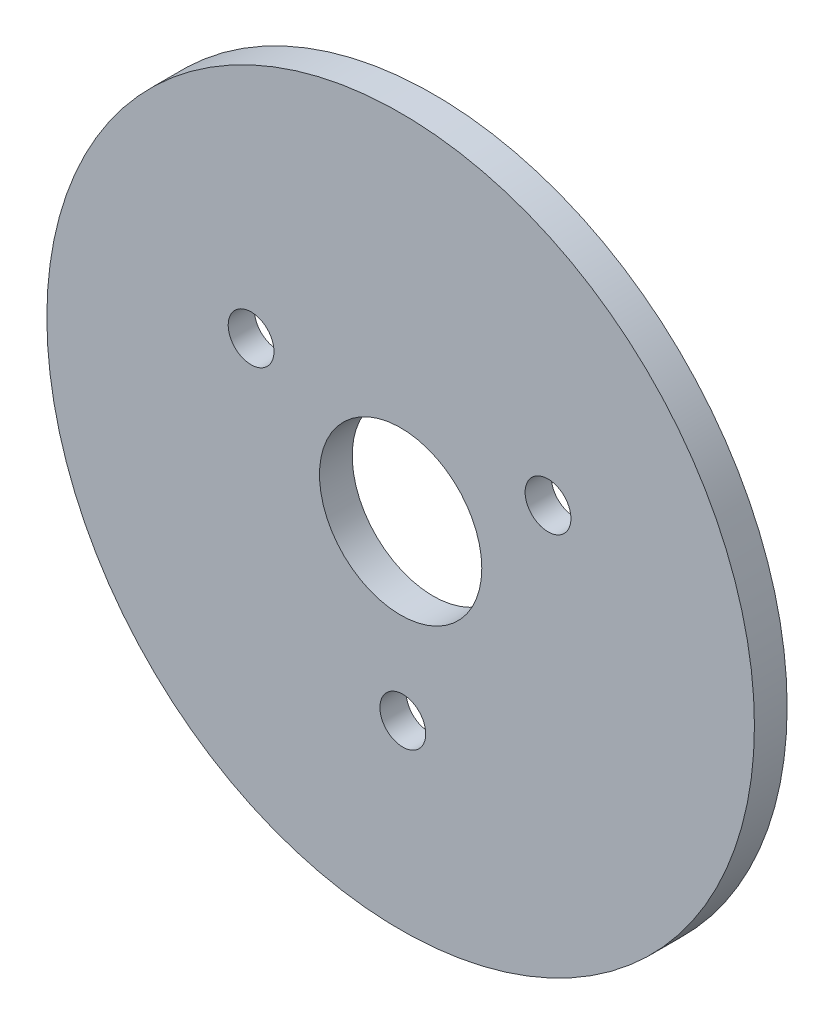
from build123d import *

# Parameters (mm, degrees)
BOSS_EXTRUDE1_DEPTH      = 7.25
BOSS_EXTRUDE1_DEPTH_BACK = 7.25
SKETCH7_R                = 22.031647778
CUT_EXTRUDE3_DEPTH       = 36.98314894
CUT_EXTRUDE3_DEPTH_BACK  = 36.98314894
SKETCH15_R               = 8.008120878
SKETCH15_R_2             = 2.25
BOSS_EXTRUDE2_DEPTH      = 5.5
SKETCH16_R               = 5
CUT_EXTRUDE4_DEPTH       = 3
BOSS_EXTRUDE3_START      = 7.5
SKETCH17_R               = 22.031647778
SKETCH17_R_2             = 5
BOSS_EXTRUDE3_DEPTH      = 7.5
CUT_EXTRUDE2_DEPTH       = 36.98314894
CUT_EXTRUDE2_DEPTH_BACK  = 36.98314894
FILLET2_R                = 0.51
BOSS_EXTRUDE4_START      = 2.5
SKETCH18_R               = 27.031647778
SKETCH18_R_2             = 22.031647778
SKETCH18_R_3             = 5
BOSS_EXTRUDE4_DEPTH      = 2.5
BOSS_EXTRUDE5_START      = -2.5
SKETCH19_R               = 27.031647778
SKETCH19_R_2             = 19
BOSS_EXTRUDE5_DEPTH      = 2.5
CUT_EXTRUDE5_DEPTH       = 52.999831377
SKETCH21_R               = 8.008120878
SKETCH21_R_2             = 6.2
SKETCH21_R_3             = 2.25
BOSS_EXTRUDE6_DEPTH      = 2.5
SKETCH21_4_R             = 8.008120878
SKETCH21_4_R_2           = 6.2
BOSS_EXTRUDE7_DEPTH      = 12
CUT_EXTRUDE6_DEPTH       = 43.254230122
CUT_EXTRUDE6_DEPTH_BACK  = 43.254230122
SKETCH22_W               = 54.063295556
SKETCH22_H               = 32.75
SKETCH24_R               = 1.75
CUT_EXTRUDE7_DEPTH       = 39.310180934
SKETCH24_3_R             = 5
SKETCH24_3_R_2           = 1.75
CUT_EXTRUDE8_DEPTH       = 0.5
FILLET4_R                = 0.5


with BuildPart() as part:
    # Sketch7 → Boss-Extrude1 (new, two sides: drawn at the far end of the back side and taken through both)
    with BuildSketch(Plane.XY.offset(-BOSS_EXTRUDE1_DEPTH_BACK)):
        Circle(SKETCH7_R)
    extrude(amount=BOSS_EXTRUDE1_DEPTH + BOSS_EXTRUDE1_DEPTH_BACK)

    # Sketch14 → Revolve1 (revolve)
    with BuildSketch(Plane(origin=(0, 0, 0), x_dir=(0, 0, -1), z_dir=(1, 0, 0)), mode=Mode.PRIVATE) as revolve1_sk:
        Polygon((-18, 6.739517467), (-18, 0), (0, 0), (0, 19), (-3.355534752, 19), (-11.020158508, 12.583105693), align=None)
        with BuildLine():
            ThreePointArc((-7.25, 19), (-8.580081567, 15.465471544), (-11.020158508, 12.583105693))
            Line((-11.020158508, 12.583105693), (-3.355534752, 19))
            Line((-3.355534752, 19), (-7.25, 19))
        make_face()
        with BuildLine():
            Line((-18, 10), (-18, 6.739517467))
            Line((-18, 6.739517467), (-11.020158508, 12.583105693))
            ThreePointArc((-11.020158508, 12.583105693), (-14.286666254, 10.687865845), (-18, 10))
        make_face()
    revolve(revolve1_sk.sketch.rotate(Axis((0, 0, -36.129595921), (0, 0, 1)), 270), axis=Axis((0, 0, -36.129595921), (0, 0, 1)))

    # Sketch10 → Cut-Extrude3 (cut, two sides: drawn at the far end of the back side and taken through both)
    with BuildSketch(Plane.XY.offset(-CUT_EXTRUDE3_DEPTH_BACK)):
        with BuildLine():
            Line((2.2, 7.7), (-2.2, 7.7))
            Line((-2.2, 7.7), (-2.2, 5.796550698))
            ThreePointArc((-2.2, 5.796550698), (0, 6.2), (2.2, 5.796550698))
            Line((2.2, 5.796550698), (2.2, 7.7))
        make_face()
        with BuildLine():
            ThreePointArc((2.2, 5.796550698), (0, 6.2), (-2.2, 5.796550698))
            Line((-2.2, 5.796550698), (-2.2, 0))
            Line((-2.2, 0), (2.2, 0))
            Line((2.2, 0), (2.2, 5.796550698))
        make_face()
        with BuildLine():
            Line((-2.2, 0), (-2.2, 5.796550698))
            ThreePointArc((-2.2, 5.796550698), (-3.521363372, -5.102940329), (6.2, 0))
            ThreePointArc((6.2, 0), (5.102940329, 3.521363372), (2.2, 5.796550698))
            Line((2.2, 5.796550698), (2.2, 0))
            Line((2.2, 0), (-2.2, 0))
        make_face()
    extrude(amount=CUT_EXTRUDE3_DEPTH + CUT_EXTRUDE3_DEPTH_BACK, mode=Mode.SUBTRACT)

    # Sketch15 → Boss-Extrude2 (add)
    with BuildSketch(Plane(origin=(0, 0, -7.25), x_dir=(-1, 0, 0), z_dir=(0, 0, -1))):
        Circle(SKETCH15_R)
        Circle(SKETCH15_R_2, mode=Mode.SUBTRACT)
    extrude(amount=-BOSS_EXTRUDE2_DEPTH)

    # Sketch16 → Cut-Extrude4 (cut)
    with BuildSketch(Plane(origin=(0, 0, -7.25), x_dir=(-1, 0, 0), z_dir=(0, 0, -1))):
        Circle(SKETCH16_R)
    extrude(amount=-CUT_EXTRUDE4_DEPTH, mode=Mode.SUBTRACT)

    # Sketch17 → Boss-Extrude3 (add)
    with BuildSketch(Plane(origin=(0, 0, -7.25), x_dir=(-1, 0, 0), z_dir=(0, 0, -1)).offset(BOSS_EXTRUDE3_START)):
        with Locations(Location((0, 0, 0), (0, 0, 180))):
            Circle(SKETCH17_R)
        Circle(SKETCH17_R_2, mode=Mode.SUBTRACT)
    extrude(amount=-BOSS_EXTRUDE3_DEPTH)

    # Sketch8 → Cut-Extrude2 (cut, two sides: drawn at the far end of the back side and taken through both)
    with BuildSketch(Plane.XY.offset(-CUT_EXTRUDE2_DEPTH_BACK)):
        Polygon((-1.629816853, 19.998625671), (-2.369776385, 22.031647778), (2.369776385, 22.031647778), (1.629816853, 19.998625671), align=None)
        Polygon((6.645262089, 18.932559877), (6.796180007, 21.090786644), (11.125976911, 19.16303686), (9.623085654, 17.606747406), align=None)
        Polygon((13.771314846, 14.592882482), (14.787015134, 16.503136895), (17.958394952, 12.980962779), (15.952435523, 12.170502561), align=None)
        Polygon((18.516182157, 7.729963135), (20.221041008, 9.061944851), (21.68564336, 4.554362304), (19.523464367, 4.629867259), align=None)
        Polygon((20.059433359, -0.469537064), (22.15866519, 0.053860216), (21.663247022, -4.659728787), (19.718708857, -3.711314154), align=None)
        Polygon((18.134226299, -8.587850038), (20.264854855, -8.963537338), (17.89507847, -13.06811044), (16.504409446, -11.410775634), align=None)
        Polygon((13.073446767, -15.221245722), (14.867067016, -16.431057856), (11.032688279, -19.216897077), (10.436347704, -17.137210342), align=None)
        Polygon((5.752149521, -19.222749741), (6.898628226, -21.057499199), (2.262646056, -22.042907629), (2.563746633, -19.900465696), align=None)
        Polygon((-2.563746633, -19.900465696), (-2.262646056, -22.042907629), (-6.898628226, -21.057499199), (-5.752149521, -19.222749741), align=None)
        Polygon((-10.436347704, -17.137210342), (-11.032688279, -19.216897077), (-14.867067016, -16.431057856), (-13.073446767, -15.221245722), align=None)
        Polygon((-16.504409446, -11.410775634), (-17.89507847, -13.06811044), (-20.264854855, -8.963537338), (-18.134226299, -8.587850038), align=None)
        Polygon((-19.718708857, -3.711314154), (-21.663247022, -4.659728787), (-22.15866519, 0.053860216), (-20.059433359, -0.469537064), align=None)
        Polygon((-19.523464367, 4.629867259), (-21.68564336, 4.554362304), (-20.221041008, 9.061944851), (-18.516182157, 7.729963135), align=None)
        Polygon((-15.952435523, 12.170502561), (-17.958394952, 12.980962779), (-14.787015134, 16.503136895), (-13.771314846, 14.592882482), align=None)
        Polygon((-9.623085654, 17.606747406), (-11.125976911, 19.16303686), (-6.796180007, 21.090786644), (-6.645262089, 18.932559877), align=None)
    extrude(amount=CUT_EXTRUDE2_DEPTH + CUT_EXTRUDE2_DEPTH_BACK, mode=Mode.SUBTRACT)

    # Fillet2
    fillet2_edges = [part.edges().sort_by_distance(p)[0] for p in [
        (6.787047671, 20.960188161, -3.75),
        (11.035034049, 19.06886277, -3.75),
        (9.623085654, 17.606747406, -3.75),
        (6.645262089, 18.932559877, -3.75),
        (14.725553141, 16.387543699, -3.75),
        (17.837010461, 12.931920261, -3.75),
        (15.952435523, 12.170502561, -3.75),
        (13.771314846, 14.592882482, -3.75),
        (20.117876696, 8.981344056, -3.75),
        (21.55480572, 4.558931255, -3.75),
        (19.523464367, 4.629867259, -3.75),
        (18.516182157, 7.729963135, -3.75),
        (22.031636605, 0.022188433, -3.75),
        (21.545579251, -4.60233838, -3.75),
        (19.718708857, -3.711314154, -3.75),
        (20.059433359, -0.469537064, -3.75),
        (20.135926394, -8.940803772, -3.75),
        (17.810926394, -12.9678219, -3.75),
        (16.504409446, -11.410775634, -3.75),
        (18.134226299, -8.587850038, -3.75),
        (14.75853158, -16.35784978, -3.75),
        (10.996602556, -19.091051203, -3.75),
        (10.436347704, -17.137210342, -3.75),
        (13.073446767, -15.221245722, -3.75),
        (6.829252579, -20.946474955, -3.75),
        (2.280866235, -21.913264317, -3.75),
        (2.563746633, -19.900465696, -3.75),
        (5.752149521, -19.222749741, -3.75),
        (-2.280866235, -21.913264317, -3.75),
        (-6.829252579, -20.946474955, -3.75),
        (-5.752149521, -19.222749741, -3.75),
        (-2.563746633, -19.900465696, -3.75),
        (-10.996602556, -19.091051203, -3.75),
        (-14.75853158, -16.35784978, -3.75),
        (-13.073446767, -15.221245722, -3.75),
        (-10.436347704, -17.137210342, -3.75),
        (-17.810926394, -12.9678219, -3.75),
        (-20.135926394, -8.940803772, -3.75),
        (-18.134226299, -8.587850038, -3.75),
        (-16.504409446, -11.410775634, -3.75),
        (-21.545579251, -4.60233838, -3.75),
        (-22.031636605, 0.022188433, -3.75),
        (-20.059433359, -0.469537064, -3.75),
        (-19.718708857, -3.711314154, -3.75),
        (-21.55480572, 4.558931255, -3.75),
        (-20.117876696, 8.981344056, -3.75),
        (-18.516182157, 7.729963135, -3.75),
        (-19.523464367, 4.629867259, -3.75),
        (-17.837010461, 12.931920261, -3.75),
        (-14.725553141, 16.387543699, -3.75),
        (-13.771314846, 14.592882482, -3.75),
        (-15.952435523, 12.170502561, -3.75),
        (-11.035034049, 19.06886277, -3.75),
        (-6.787047671, 20.960188161, -3.75),
        (-6.645262089, 18.932559877, -3.75),
        (-9.623085654, 17.606747406, -3.75),
        (-2.325, 21.908625671, -3.75),
        (2.325, 21.908625671, -3.75),
        (1.629816853, 19.998625671, -3.75),
        (-1.629816853, 19.998625671, -3.75),
    ]]
    fillet(fillet2_edges, radius=FILLET2_R)

    # Sketch18 → Boss-Extrude4 (add)
    # profile 1 of 2: a face of its own
    with BuildSketch(Plane(origin=(0, 0, -14.75), x_dir=(-1, 0, 0), z_dir=(0, 0, -1)).offset(BOSS_EXTRUDE4_START)):
        Circle(SKETCH18_R)
        Circle(SKETCH18_R_2, mode=Mode.SUBTRACT)
    # profile 2 of 2: a face of its own
    with BuildSketch(Plane(origin=(0, 0, -14.75), x_dir=(-1, 0, 0), z_dir=(0, 0, -1)).offset(BOSS_EXTRUDE4_START)):
        Circle(SKETCH18_R_2)
        Circle(SKETCH18_R_3, mode=Mode.SUBTRACT)
    extrude(amount=-BOSS_EXTRUDE4_DEPTH)

    # Sketch19 → Boss-Extrude5 (add)
    with BuildSketch(Plane.XY.offset(7.25).offset(BOSS_EXTRUDE5_START)):
        with Locations(Location((0, 0, 0), (0, 0, 180))):
            Circle(SKETCH19_R)
        Circle(SKETCH19_R_2, mode=Mode.SUBTRACT)
    extrude(amount=BOSS_EXTRUDE5_DEPTH)

    # Sketch20 → Cut-Extrude5 (cut, through all)
    with BuildSketch(Plane.XY.offset(18)):
        with BuildLine():
            Line((-2.2, 7.7), (-2.2, 5.796550698))
            ThreePointArc((-2.2, 5.796550698), (0, 6.2), (2.2, 5.796550698))
            Line((2.2, 5.796550698), (2.2, 7.7))
            Line((2.2, 7.7), (-2.2, 7.7))
        make_face()
        with BuildLine():
            ThreePointArc((2.2, 5.796550698), (0, 6.2), (-2.2, 5.796550698))
            ThreePointArc((-2.2, 5.796550698), (-3.521363372, -5.102940329), (6.2, 0))
            ThreePointArc((6.2, 0), (5.102940329, 3.521363372), (2.2, 5.796550698))
        make_face()
    extrude(amount=-CUT_EXTRUDE5_DEPTH, mode=Mode.SUBTRACT)

    # Sketch21 → Boss-Extrude6 (add)
    # profile 1 of 2: a face of its own
    with BuildSketch(Plane.XY.offset(-5.25)):
        Circle(SKETCH21_R)
        Circle(SKETCH21_R_2, mode=Mode.SUBTRACT)
    # profile 2 of 2: a face of its own
    with BuildSketch(Plane.XY.offset(-5.25)):
        Circle(SKETCH21_R_2)
        Circle(SKETCH21_R_3, mode=Mode.SUBTRACT)
    extrude(amount=-BOSS_EXTRUDE6_DEPTH)

    # Sketch21<4> → Boss-Extrude7 (add)
    with BuildSketch(Plane.XY.offset(-5.25)):
        Circle(SKETCH21_4_R)
        Circle(SKETCH21_4_R_2, mode=Mode.SUBTRACT)
    extrude(amount=-BOSS_EXTRUDE7_DEPTH)

    # Sketch22 → Cut-Extrude6 (cut, two sides: drawn at the far end of the back side and taken through both)
    with BuildSketch(Plane(origin=(0, 0, 0), x_dir=(1, 0, 0), z_dir=(0, 1, 0)).offset(-CUT_EXTRUDE6_DEPTH_BACK)):
        with Locations((0, -1.625)):
            Rectangle(SKETCH22_W, SKETCH22_H)
    extrude(amount=CUT_EXTRUDE6_DEPTH + CUT_EXTRUDE6_DEPTH_BACK, mode=Mode.SUBTRACT)

    # Sketch24 → Cut-Extrude7 (cut, through all)
    with BuildSketch(Plane(origin=(0, 0, -17.25), x_dir=(-1, 0, 0), z_dir=(0, 0, -1))):
        with Locations((11.42637589, 6.405461013)):
            Circle(SKETCH24_R)
        with Locations((-0.165895985, -13.0982623)):
            Circle(SKETCH24_R)
        with Locations((-11.260479905, 6.692801288)):
            Circle(SKETCH24_R)
    extrude(amount=-CUT_EXTRUDE7_DEPTH, mode=Mode.SUBTRACT)

    # Sketch24<3> → Cut-Extrude8 (cut)
    # profile 1 of 3: a face of its own
    with BuildSketch(Plane(origin=(0, 0, -17.25), x_dir=(-1, 0, 0), z_dir=(0, 0, -1))):
        with Locations((-11.260479905, 6.692801288)):
            Circle(SKETCH24_3_R)
        with Locations((-11.260479905, 6.692801288)):
            Circle(SKETCH24_3_R_2, mode=Mode.SUBTRACT)
    # profile 2 of 3: a face of its own
    with BuildSketch(Plane(origin=(0, 0, -17.25), x_dir=(-1, 0, 0), z_dir=(0, 0, -1))):
        with Locations((11.42637589, 6.405461013)):
            Circle(SKETCH24_3_R)
        with Locations((11.42637589, 6.405461013)):
            Circle(SKETCH24_3_R_2, mode=Mode.SUBTRACT)
    # profile 3 of 3: a face of its own
    with BuildSketch(Plane(origin=(0, 0, -17.25), x_dir=(-1, 0, 0), z_dir=(0, 0, -1))):
        with Locations((-0.165895985, -13.0982623)):
            Circle(SKETCH24_3_R)
        with Locations((-0.165895985, -13.0982623)):
            Circle(SKETCH24_3_R_2, mode=Mode.SUBTRACT)
    extrude(amount=-CUT_EXTRUDE8_DEPTH, mode=Mode.SUBTRACT)

    # Fillet4
    fillet4_edges = [part.edges().sort_by_distance(p)[0] for p in [
        (16.260479905, 6.692801288, -17.25),
        (-6.42637589, 6.405461013, -17.25),
        (5.165895985, -13.0982623, -17.25),
    ]]
    fillet(fillet4_edges, radius=FILLET4_R - 0.0001)  # a hair under: the kernel refuses the full size


solid = part.part
